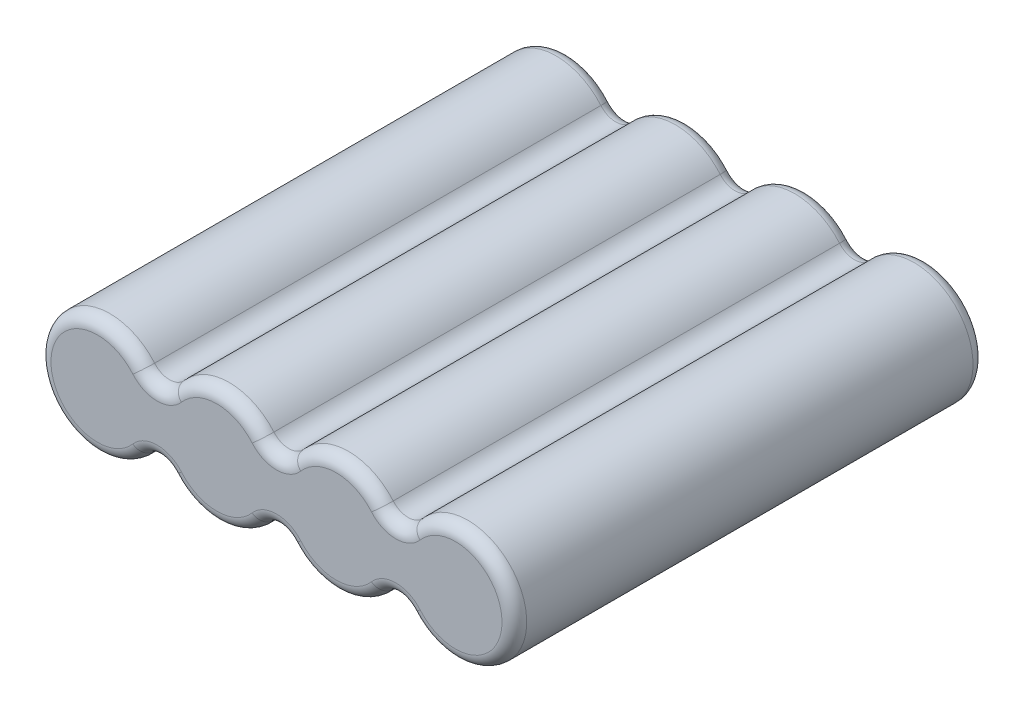
from build123d import *

# Parameters (mm, degrees)
BOSS_EXTRUDE1_DEPTH = 38.1
FILLET2_R           = 1


with BuildPart() as part:
    # Sketch1 → Boss-Extrude1 (new body)
    with BuildSketch(Plane.XY):
        with BuildLine():
            ThreePointArc((3.6195, 3.095258632), (-4.7625, 0), (3.6195, -3.095258632))
            ThreePointArc((3.6195, -3.095258632), (4.826, -2.53951151), (6.0325, -3.095258632))
            ThreePointArc((6.0325, -3.095258632), (9.652, -4.7625), (13.2715, -3.095258632))
            ThreePointArc((13.2715, -3.095258632), (14.478, -2.53951151), (15.6845, -3.095258632))
            ThreePointArc((15.6845, -3.095258632), (19.304, -4.7625), (22.9235, -3.095258632))
            ThreePointArc((22.9235, -3.095258632), (24.13, -2.53951151), (25.3365, -3.095258632))
            ThreePointArc((25.3365, -3.095258632), (33.7185, 0), (25.3365, 3.095258632))
            ThreePointArc((25.3365, 3.095258632), (24.13, 2.53951151), (22.9235, 3.095258632))
            ThreePointArc((22.9235, 3.095258632), (19.304, 4.7625), (15.6845, 3.095258632))
            ThreePointArc((15.6845, 3.095258632), (14.478, 2.53951151), (13.2715, 3.095258632))
            ThreePointArc((13.2715, 3.095258632), (9.652, 4.7625), (6.0325, 3.095258632))
            ThreePointArc((6.0325, 3.095258632), (4.826, 2.53951151), (3.6195, 3.095258632))
        make_face()
    extrude(amount=BOSS_EXTRUDE1_DEPTH)

    # Fillet2
    fillet2_edges = [part.edges().sort_by_distance(p)[0] for p in [
        (4.826, 2.53951151, 38.1),
        (9.652, 4.7625, 38.1),
        (14.478, 2.53951151, 38.1),
        (19.304, 4.7625, 38.1),
        (24.13, 2.53951151, 38.1),
        (33.7185, 0, 38.1),
        (24.13, -2.53951151, 38.1),
        (19.304, -4.7625, 38.1),
        (14.478, -2.53951151, 38.1),
        (9.652, -4.7625, 38.1),
        (4.826, -2.53951151, 38.1),
        (4.826, 2.53951151, 0),
        (9.652, 4.7625, 0),
        (14.478, 2.53951151, 0),
        (19.304, 4.7625, 0),
        (24.13, 2.53951151, 0),
        (33.7185, 0, 0),
        (24.13, -2.53951151, 0),
        (19.304, -4.7625, 0),
        (14.478, -2.53951151, 0),
        (9.652, -4.7625, 0),
        (4.826, -2.53951151, 0),
        (-4.7625, 0, 38.1),
        (-4.7625, 0, 0),
    ]]
    fillet(fillet2_edges, radius=FILLET2_R)


solid = part.part
